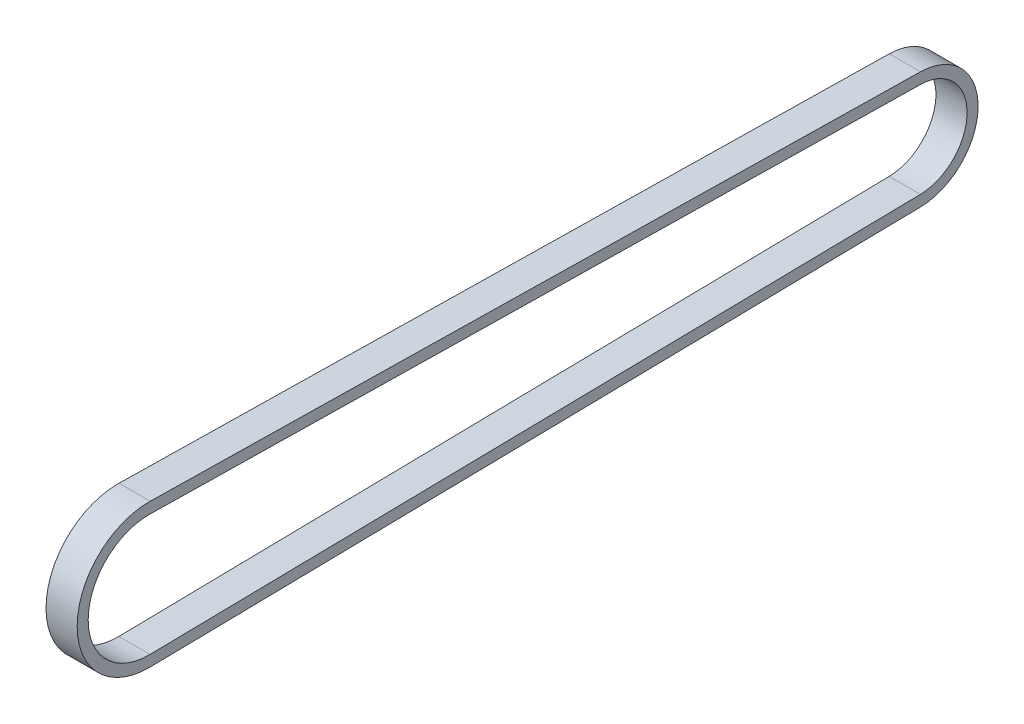
from build123d import *

# Parameters (mm, degrees)
BOSS_EXTRUDE1_DEPTH = 4.5


with BuildPart() as part:
    # Sketch1 → Boss-Extrude1 (new, symmetric)
    with BuildSketch(Plane(origin=(0, 0, 0), x_dir=(0, 0, -1), z_dir=(1, 0, 0))):
        with BuildLine():
            Line((0.355957259, 20.720802777), (222.700361409, 16.901206334))
            ThreePointArc((222.700361409, 16.901206334), (239.31372, 0), (222.700361409, -16.901206334))
            Line((222.700361409, -16.901206334), (0.355957259, -20.720802777))
            ThreePointArc((0.355957259, -20.720802777), (-20.72386, 0), (0.355957259, 20.720802777))
        make_face()
        with BuildLine():
            Line((0.301422809, 17.546271159), (222.64582696, 13.726674716))
            ThreePointArc((222.64582696, 13.726674716), (236.13872, 0), (222.64582696, -13.726674716))
            Line((222.64582696, -13.726674716), (0.301422809, -17.546271159))
            ThreePointArc((0.301422809, -17.546271159), (-17.54886, 0), (0.301422809, 17.546271159))
        make_face(mode=Mode.SUBTRACT)
    extrude(amount=BOSS_EXTRUDE1_DEPTH, both=True)


solid = part.part
